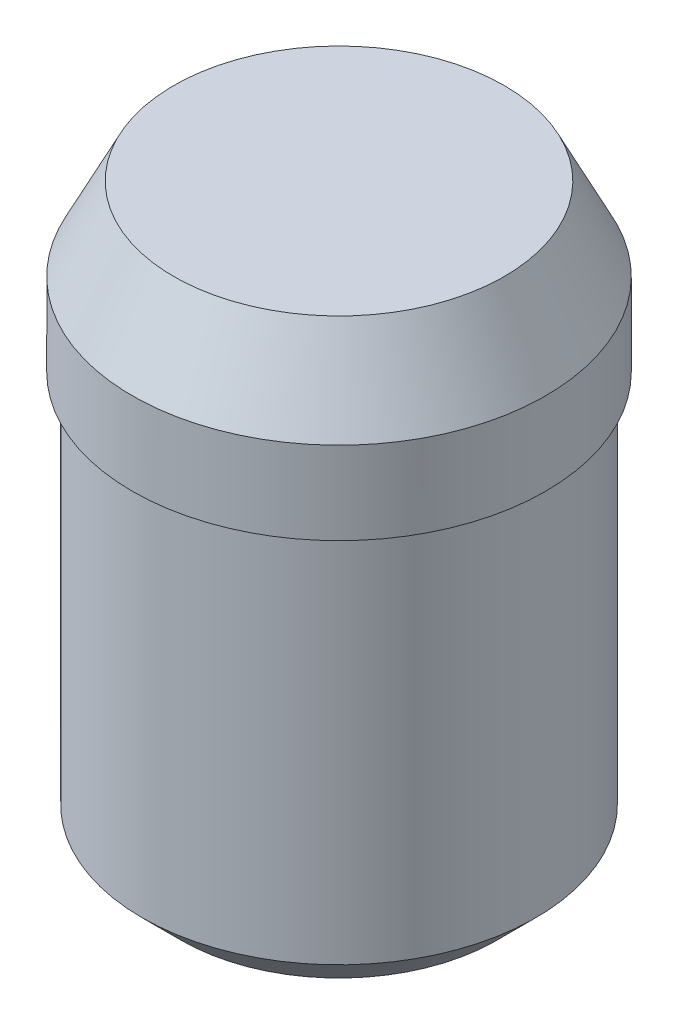
from build123d import *


# Read off the part's stored shape, not the designer's step: 3/8-16 机械螺纹 螺柱1
with BuildPart() as part:
    # 草图1 → 旋转3 (revolve)
    with BuildSketch(Plane.XY, mode=Mode.PRIVATE) as revolve_3_sk:
        Polygon((0, 0), (0, 14), (-4, 14), (-5, 12), (-5, 0), align=None)
    revolve(revolve_3_sk.sketch.rotate(Axis((0, 0, 0), (0, 1, 0)), 270), axis=Axis((0, 0, 0), (0, 1, 0)))

    # 3/8-16 机械螺纹 螺柱1 outline → 3/8-16 机械螺纹 螺柱1 (revolve, cut)
    with BuildSketch(Plane.XY):
        Polygon((3.81635, 0), (5, 0), (5, 10), (4.7625, 10), (4.7625, 0.94615), align=None)
    revolve(axis=Axis((0, 0, 0), (0, 1, 0)), mode=Mode.SUBTRACT)


solid = part.part
